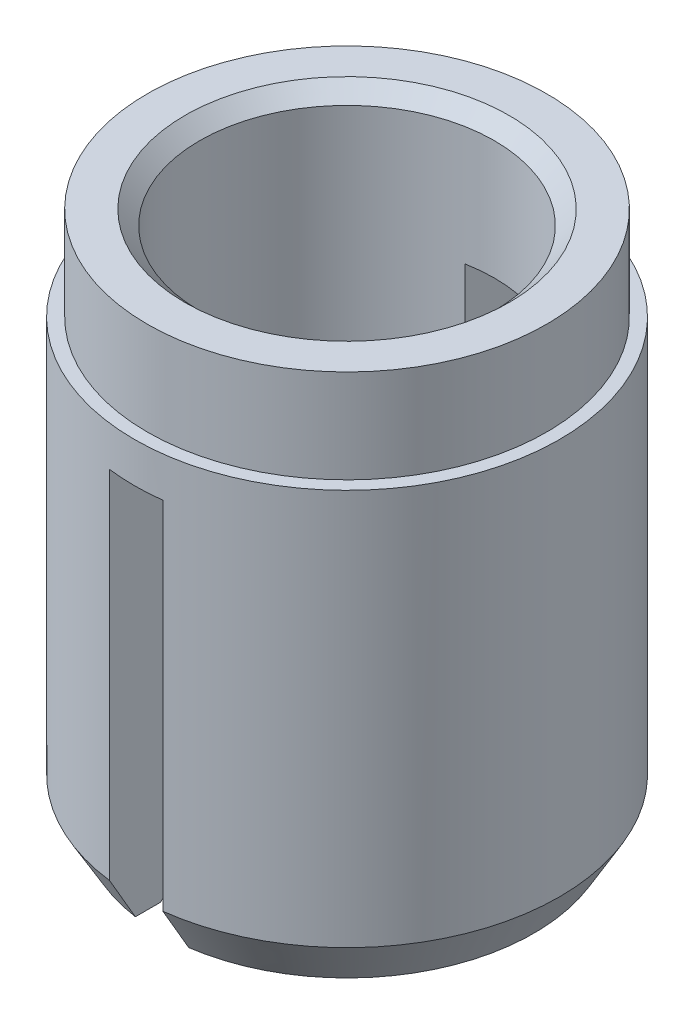
from build123d import *

# Parameters (mm, degrees)
BOSS_EXTRUDE1_DEPTH      = 3.175
BOSS_EXTRUDE1_DEPTH_BACK = 3.175
SKETCH11_R               = 2.5273
SKETCH11_R_2             = 1.7526
CUT_EXTRUDE1_START       = 2.06375
SKETCH12_R               = 2.5273
SKETCH12_R_2             = 2.3749
CUT_EXTRUDE1_DEPTH       = 1.11125
CHAMFER2_SIZE            = 0.3048
CHAMFER2_SIZE2           = 0.527929086
EXTRUDE4_DEPTH           = 5.780702415
EXTRUDE4_DEPTH_BACK      = 5.780702415
SKETCH8_W                = 0.635
SKETCH8_H                = 4.7625


# Read off the part's stored shape, not the designer's step: Cut-Extrude3, Cut-Extrude10
with BuildPart() as part:
    # Sketch11 → Boss-Extrude1 (new, two sides: drawn at the far end of the back side and taken through both)
    with BuildSketch(Plane(origin=(0, 0, 0), x_dir=(1, 0, 0), z_dir=(0, 1, 0)).offset(-BOSS_EXTRUDE1_DEPTH_BACK)):
        with Locations(Location((0, 0, 0), (0, 0, 90))):
            Circle(SKETCH11_R)
        with Locations(Location((0, 0, 0), (0, 0, 90))):
            Circle(SKETCH11_R_2, mode=Mode.SUBTRACT)
    extrude(amount=BOSS_EXTRUDE1_DEPTH + BOSS_EXTRUDE1_DEPTH_BACK)

    # Sketch12 → Cut-Extrude1 (cut)
    with BuildSketch(Plane(origin=(0, 0, 0), x_dir=(1, 0, 0), z_dir=(0, 1, 0)).offset(CUT_EXTRUDE1_START)):
        with Locations(Location((0, 0, 0), (0, 0, 90))):
            Circle(SKETCH12_R)
        with Locations(Location((0, 0, 0), (0, 0, 270))):
            Circle(SKETCH12_R_2, mode=Mode.SUBTRACT)
    extrude(amount=CUT_EXTRUDE1_DEPTH, mode=Mode.SUBTRACT)

    # Cut-Extrude3 outline → Cut-Extrude3 (revolve, cut)
    with BuildSketch(Plane.XY):
        Polygon((1.7526, 3.175), (1.7526, 3.002772478), (1.92786, 3.175), align=None)
    revolve(axis=Axis((0, 0, 0), (0, 1, 0)), mode=Mode.SUBTRACT)

    # Cut-Extrude10 outline → Cut-Extrude10 (revolve, cut)
    with BuildSketch(Plane.XY):
        Polygon((1.92786, -3.175), (1.7526, -3.002772478), (1.7526, -3.175), align=None)
    revolve(axis=Axis((0, 0, 0), (0, 1, 0)), mode=Mode.SUBTRACT)

    # Chamfer2
    chamfer2_edges = [part.edges().sort_by_distance(p)[0] for p in [
        (0, -3.175, 2.5273),
    ]]
    chamfer2_side = [part.faces().sort_by_distance(p)[0] for p in [
        (0, -3.175, 2.455817161),
    ]]
    chamfer(chamfer2_edges, length=CHAMFER2_SIZE, length2=CHAMFER2_SIZE2, reference=chamfer2_side[0])

    # Sketch8 → Extrude4 (cut, two sides: drawn at the far end of the back side and taken through both)
    with BuildSketch(Plane.XY.offset(-EXTRUDE4_DEPTH_BACK)):
        with Locations((0, -0.79375)):
            Rectangle(SKETCH8_W, SKETCH8_H)
    extrude(amount=EXTRUDE4_DEPTH + EXTRUDE4_DEPTH_BACK, mode=Mode.SUBTRACT)


solid = part.part
